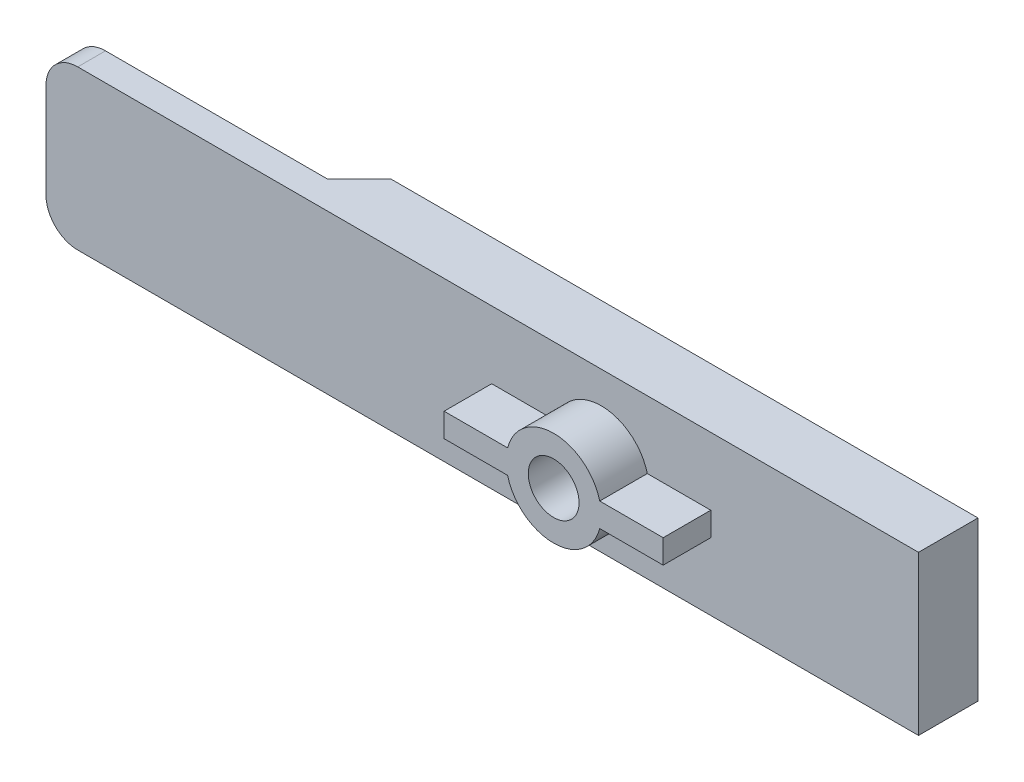
from build123d import *

# Parameters (mm, degrees)
SKETCH_1_W          = 40
SKETCH_1_H          = 10
EXTRUDE_1_DEPTH     = 1.75
SKETCH_3_W          = 4
SKETCH_3_H          = 10
EXTRUDE_3_DEPTH     = 2
SKETCH_4_W          = 15
SKETCH_4_H          = 1.5
SKETCH_4_W_2        = 3
SKETCH_4_H_2        = 3.5
EXTRUDE_4_DEPTH     = 2
CHAMFER_1_SIZE      = 1
SKETCH_6_R          = 3
SKETCH_6_R_2        = 1.6
EXTRUDE_5_DEPTH     = 3
SKETCH_7_W          = 1.75
SKETCH_7_H          = 10
EXTRUDE_6_DEPTH     = 10
SKETCH_8_W          = 4
SKETCH_8_H          = 1.5
EXTRUDE_7_DEPTH     = 3
SKETCH_9_W          = 33
SKETCH_9_H          = 10
EXTRUDE_8_DEPTH     = 2
CHAMFER_2_SIZE      = 3
SKETCH_10_W         = 1.75
SKETCH_10_H         = 10
EXTRUDE_9_DEPTH     = 5
FILLET_1_R          = 2
CUT_EXTRUDE_START   = -1.75
SKETCH_11_R         = 1.6
CUT_EXTRUDE_1_DEPTH = 1.75
SKETCH_12_W         = 18
SKETCH_12_H         = 2
EXTRUDE_10_DEPTH    = 2


# Some blends are built 0.0001 mm under size
with BuildPart() as part:
    # 草图1 → 凸台-拉伸1 (new body)
    with BuildSketch(Plane.XY):
        with Locations((20, 5)):
            Rectangle(SKETCH_1_W, SKETCH_1_H)
    extrude(amount=EXTRUDE_1_DEPTH)

    # 草图3 → 凸台-拉伸3 (add)
    with BuildSketch(Plane(origin=(0, 0, 0), x_dir=(-1, 0, 0), z_dir=(0, 0, -1))):
        with Locations((-38, 5)):
            Rectangle(SKETCH_3_W, SKETCH_3_H)
    extrude(amount=EXTRUDE_3_DEPTH)

    # 草图4 → 凸台-拉伸4 (add)
    with BuildSketch(Plane(origin=(0, 0, 0), x_dir=(-1, 0, 0), z_dir=(0, 0, -1))):
        with Locations((-28.5, 5.75)):
            Rectangle(SKETCH_4_W, SKETCH_4_H)
        with Locations((-28.5, 4.25)):
            Rectangle(SKETCH_4_W, SKETCH_4_H)
        with Locations((-19.5, 5.75)):
            Rectangle(SKETCH_4_W_2, SKETCH_4_H)
        with Locations((-19.5, 4.25)):
            Rectangle(SKETCH_4_W_2, SKETCH_4_H)
        with Locations((-19.5, 8.25)):
            Rectangle(SKETCH_4_W_2, SKETCH_4_H_2)
        with Locations((-19.5, 1.75)):
            Rectangle(SKETCH_4_W_2, SKETCH_4_H_2)
        with Locations((-10.5, 5.75)):
            Rectangle(SKETCH_4_W, SKETCH_4_H)
        with Locations((-10.5, 4.25)):
            Rectangle(SKETCH_4_W, SKETCH_4_H)
        with Locations((-1.5, 5.75)):
            Rectangle(SKETCH_4_W_2, SKETCH_4_H)
        with Locations((-1.5, 4.25)):
            Rectangle(SKETCH_4_W_2, SKETCH_4_H)
        with Locations((-1.5, 8.25)):
            Rectangle(SKETCH_4_W_2, SKETCH_4_H_2)
        with Locations((-1.5, 1.75)):
            Rectangle(SKETCH_4_W_2, SKETCH_4_H_2)
    extrude(amount=EXTRUDE_4_DEPTH)

    # 倒角1
    chamfer_1_edges = [part.edges().sort_by_distance(p)[0] for p in [
        (10.5, 3.5, 0),
        (28.5, 3.5, 0),
    ]]
    chamfer(chamfer_1_edges, length=CHAMFER_1_SIZE)
    chamfer_1_2_edges = [part.edges().sort_by_distance(p)[0] for p in [
        (10.5, 3.5, -2),
        (28.5, 3.5, -2),
    ]]
    chamfer(chamfer_1_2_edges, length=CHAMFER_1_SIZE - 0.0001)  # a hair under: the kernel refuses the full size

    # 草图6 → 凸台-拉伸5 (add)
    with BuildSketch(Plane.XY.offset(1.75)):
        with Locations(Location((20, 5, 0), (0, 0, 180))):
            Circle(SKETCH_6_R)
        with Locations((20, 5)):
            Circle(SKETCH_6_R_2, mode=Mode.SUBTRACT)
    extrude(amount=EXTRUDE_5_DEPTH)

    # 草图7 → 凸台-拉伸6 (add)
    with BuildSketch(Plane.ZY):
        with Locations((0.875, 5)):
            Rectangle(SKETCH_7_W, SKETCH_7_H)
    extrude(amount=EXTRUDE_6_DEPTH)

    # 草图8 → 凸台-拉伸7 (add)
    with BuildSketch(Plane.XY.offset(1.75)):
        with Locations((15.09526249, 5)):
            Rectangle(SKETCH_8_W, SKETCH_8_H)
        with Locations((24.90473751, 5)):
            Rectangle(SKETCH_8_W, SKETCH_8_H)
    extrude(amount=EXTRUDE_7_DEPTH)

    # 草图9 → 凸台-拉伸8 (add)
    with BuildSketch(Plane(origin=(0, 0, 0), x_dir=(-1, 0, 0), z_dir=(0, 0, -1))):
        with Locations((-19.5, 5)):
            Rectangle(SKETCH_9_W, SKETCH_9_H)
    extrude(amount=EXTRUDE_8_DEPTH)

    # 倒角2
    # the kernel refuses this chamfer: 3 mm, written as the material it takes off along each edge
    with BuildSketch(Plane(origin=(0, -7.715048964, -2), x_dir=(0.9996219169112968, 0, -0.027495876610586348), z_dir=(0, 1, 0))) as chamfer_2_piece_1_section:
        Polygon((CHAMFER_2_SIZE * 0.999621916911, -CHAMFER_2_SIZE * 0.0274958766106), (-CHAMFER_2_SIZE * 0.0274958766106, -CHAMFER_2_SIZE * 0.999621916911), (0, 0), align=None)
    chamfer_2_piece_1 = extrude(amount=25.430097928, mode=Mode.PRIVATE)
    chamfer_2_piece_1 = split(chamfer_2_piece_1, bisect_by=Plane(origin=(1.092091005, 5, 0), z_dir=(0, 0, -1)), keep=Keep.TOP, mode=Mode.PRIVATE)
    add(chamfer_2_piece_1, mode=Mode.SUBTRACT)

    # 草图10 → 凸台-拉伸9 (add)
    with BuildSketch(Plane.ZY.offset(10)):
        with Locations((0.875, 5)):
            Rectangle(SKETCH_10_W, SKETCH_10_H)
    extrude(amount=EXTRUDE_9_DEPTH)

    # 圆角1
    fillet_1_edges = [part.edges().sort_by_distance(p)[0] for p in [
        (-15, 10, 0.875),
        (-15, 0, 0.875),
    ]]
    fillet(fillet_1_edges, radius=FILLET_1_R)

    # 草图11 → 切除-拉伸1 (cut)
    with BuildSketch(Plane.XY.offset(1.75).offset(CUT_EXTRUDE_START)):
        with Locations(Location((20, 5, 0), (0, 0, 180))):
            Circle(SKETCH_11_R)
    extrude(amount=CUT_EXTRUDE_1_DEPTH, mode=Mode.SUBTRACT)

    # 草图12 → 凸台-拉伸10 (add)
    with BuildSketch(Plane(origin=(0, 0, 0), x_dir=(-1, 0, 0), z_dir=(0, 0, -1))):
        with Locations((6, 5)):
            Rectangle(SKETCH_12_W, SKETCH_12_H)
    extrude(amount=EXTRUDE_10_DEPTH)


solid = part.part
